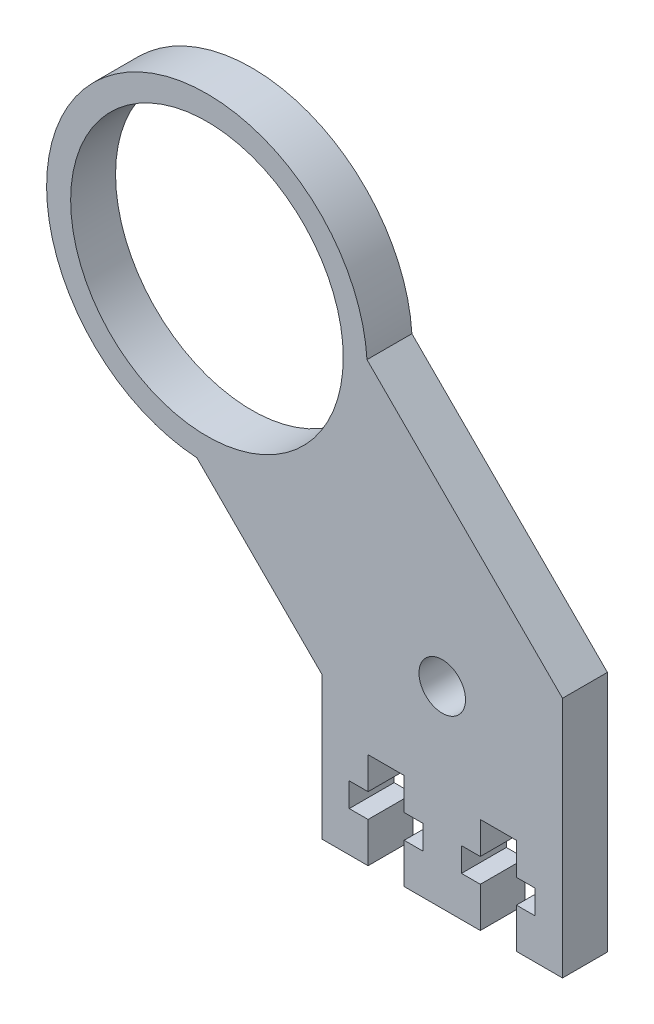
from build123d import *

# Parameters (mm, degrees)
SKETCH1_R           = 2.9
BOSS_EXTRUDE1_DEPTH = 5.6
SKETCH2_R           = 17
CUT_EXTRUDE1_DEPTH  = 71.008603139
CUT_EXTRUDE2_DEPTH  = 71.008603139


with BuildPart() as part:
    # Sketch1 → Boss-Extrude1 (new body)
    with BuildSketch(Plane.XY):
        with BuildLine():
            Line((-15, -6.213203436), (-15, -24))
            Line((-15, -24), (15, -24))
            Line((15, -24), (15, 6.213203436))
            Line((15, 6.213203436), (-9.384186235, 30.59738967))
            ThreePointArc((-9.384186235, 30.59738967), (-43.487067043, 43.487067043), (-30.59738967, 9.384186235))
            Line((-30.59738967, 9.384186235), (-15, -6.213203436))
        make_face()
        Circle(SKETCH1_R, mode=Mode.SUBTRACT)
    extrude(amount=BOSS_EXTRUDE1_DEPTH)

    # Sketch2 → Cut-Extrude1 (cut, through all)
    with BuildSketch(Plane.XY.offset(5.6)):
        with Locations((-29.344931419, 29.344931419)):
            Circle(SKETCH2_R)
    extrude(amount=-CUT_EXTRUDE1_DEPTH, mode=Mode.SUBTRACT)

    # Sketch3 → Cut-Extrude2 (cut, through all)
    with BuildSketch(Plane.XY.offset(5.6)):
        Polygon((-9.25, -24), (-4.75, -24), (-4.75, -19), (-2.4, -19), (-2.4, -16), (-4.75, -16), (-4.75, -12), (-9.25, -12), (-9.25, -16), (-11.6, -16), (-11.6, -19), (-9.25, -19), align=None)
        Polygon((4.75, -16), (4.75, -12), (9.25, -12), (9.25, -16), (11.6, -16), (11.6, -19), (9.25, -19), (9.25, -24), (4.75, -24), (4.75, -19), (2.4, -19), (2.4, -16), align=None)
    extrude(amount=-CUT_EXTRUDE2_DEPTH, mode=Mode.SUBTRACT)


solid = part.part
